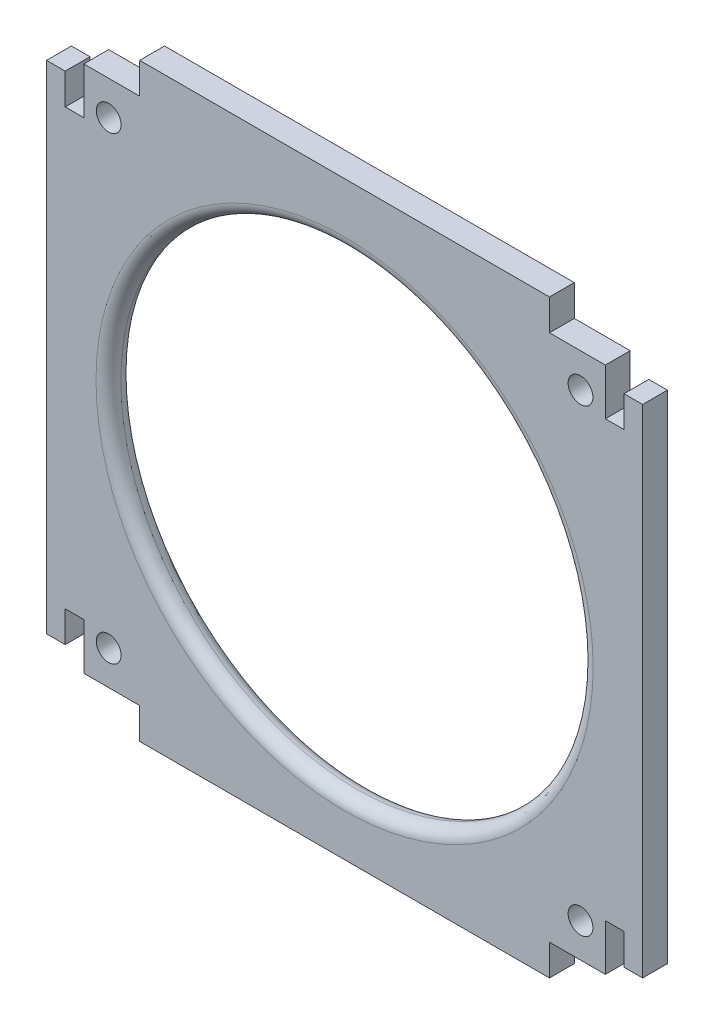
from build123d import *

# Parameters (mm, degrees)
SKETCH1_R           = 2
SKETCH1_R_2         = 38.03346271
BOSS_EXTRUDE1_DEPTH = 4
FILLET1_R           = 2


with BuildPart() as part:
    # Sketch1 → Boss-Extrude1 (new body)
    with BuildSketch(Plane.XY):
        Polygon((0, 0), (9, 0), (9, 5), (75, 5), (74.999999866, -2.502e-06), (84, 0), (84, -7.5), (87, -7.5), (87, -2.5), (90, -2.5), (90, -82.5), (87, -82.5), (87, -77.5), (84, -77.5), (84, -85.000002502), (74.999993421, -85.000002502), (74.999993042, -90.000002502), (9, -90), (9, -85), (0, -85), (0, -77.5), (-3, -77.5), (-3, -82.5), (-6, -82.5), (-6, -2.5), (-3, -2.5), (-3, -7.5), (0, -7.5), align=None)
        with Locations((4, -5.500026536)):
            Circle(SKETCH1_R, mode=Mode.SUBTRACT)
        with Locations((80.000043308, -5.499945424)):
            Circle(SKETCH1_R, mode=Mode.SUBTRACT)
        with Locations((80, -79.499973464)):
            Circle(SKETCH1_R, mode=Mode.SUBTRACT)
        with Locations((3.999956692, -79.500054576)):
            Circle(SKETCH1_R, mode=Mode.SUBTRACT)
        with Locations((41.999998297, -43.155631615)):
            Circle(SKETCH1_R_2, mode=Mode.SUBTRACT)
    extrude(amount=BOSS_EXTRUDE1_DEPTH)

    # Fillet1
    fillet1_edges = [part.edges().sort_by_distance(p)[0] for p in [
        (3.966535587, -43.155631615, 0),
        (3.966535587, -43.155631615, 4),
    ]]
    fillet(fillet1_edges, radius=FILLET1_R - 0.0001)  # a hair under: the kernel refuses the full size


solid = part.part
